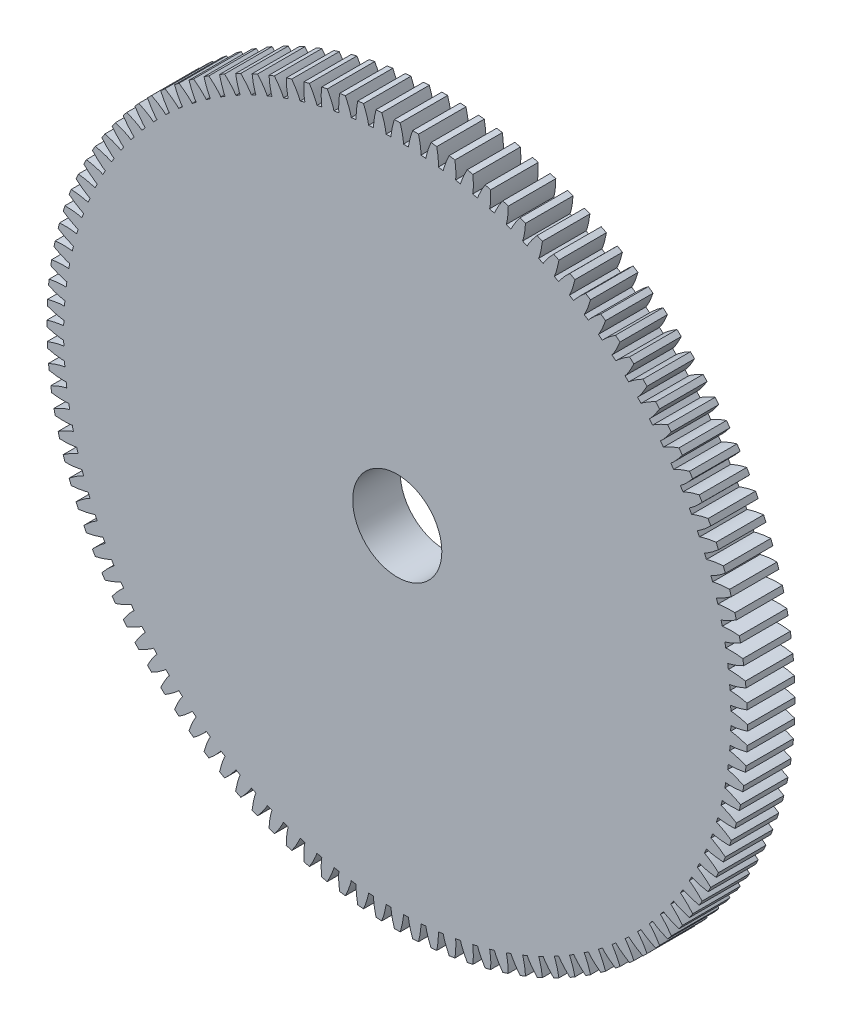
from build123d import *

# Parameters (mm, degrees)
SKETCH1_R               = 51.646666667
BOSS_EXTRUDE1_DEPTH     = 7
CUT_EXTRUDE2_DEPTH      = 9
CUT_EXTRUDE2_DEPTH_BACK = 9
SKETCH2_R               = 6.5713864
CUT_EXTRUDE4_DEPTH      = 8
CIRPATTERN1_COUNT       = 120


with BuildPart() as part:
    # Sketch1 → Boss-Extrude1 (new body)
    with BuildSketch(Plane.XY):
        Circle(SKETCH1_R)
    extrude(amount=BOSS_EXTRUDE1_DEPTH)

    # Sketch2 → Cut-Extrude2 (cut, two sides: drawn at the far end of the back side and taken through both)
    with BuildSketch(Plane.XY.offset(-CUT_EXTRUDE2_DEPTH_BACK)):
        Circle(SKETCH2_R)
    extrude(amount=CUT_EXTRUDE2_DEPTH + CUT_EXTRUDE2_DEPTH_BACK, mode=Mode.SUBTRACT)

    # Sketch3 → Cut-Extrude4 (cut, symmetric)
    with BuildSketch(Plane.XY):
        with BuildLine():
            add(Edge.make_bspline(
                [(49.173360836, 0.916442482), (49.18384042, 0.916566717), (49.203665183, 0.916389865), (49.236041745, 0.915655843), (49.281069512, 0.913831713), (49.334507278, 0.910924832), (49.397549658, 0.906541371), (49.466941868, 0.900717551), (49.542570383, 0.893292773), (49.61814797, 0.884920963), (49.693667957, 0.875669666), (49.769018057, 0.865640989), (49.860443016, 0.85252946), (49.97028668, 0.83546689), (50.099019249, 0.813561678), (50.245444605, 0.786397355), (50.395173351, 0.756216682), (50.542926147, 0.724464621), (50.692735499, 0.690005779), (50.838058678, 0.654980248), (50.989598286, 0.61614374), (51.129772372, 0.579049403), (51.287526258, 0.53475208), (51.415036017, 0.498206745), (51.54737887, 0.458157207), (51.611885358, 0.438324893), (51.64489264, 0.428045811)],
                knots=[1.3e-07, 1.3e-07, 1.3e-07, 1.3e-07, 1.3e-07, 0.015083688, 0.02853182, 0.04661014, 0.06485485, 0.092110526, 0.119476176, 0.146842496, 0.174208854, 0.201574956, 0.228941013, 0.256307345, 0.307035032, 0.361767352, 0.416499661, 0.471231937, 0.525964282, 0.580696616, 0.635428982, 0.690161387, 0.744893688, 0.799626082, 0.854358407, 0.909090989, 0.909090989, 0.909090989, 0.909090989, 0.909090989], degree=4))
            add(Edge.make_bspline(
                [(51.64489264, 0.428045811), (51.729651536, 0.428748255), (51.893906687, 0.430109643), (52.306530901, 0.433529575), (52.626157698, 0.436178722), (53.078541106, 0.439928189), (53.448425948, 0.442993886), (53.867627873, 0.446468337), (54.246446373, 0.449608079), (54.654621988, 0.45299114), (55.038305363, 0.456171204), (55.432204014, 0.459435934), (55.822263272, 0.462668842), (56.205473452, 0.465844984), (56.602827488, 0.469138353), (56.995750762, 0.472394999), (57.400093172, 0.47574629), (57.791188074, 0.478987782), (58.210246004, 0.482461039), (58.578360763, 0.485512066), (59.036526598, 0.489309459), (59.34843758, 0.491894655), (59.757270843, 0.495283167), (59.9172769, 0.496609337), (59.997819258, 0.497276892)],
                knots=[0.083333333, 0.083333333, 0.083333333, 0.083333333, 0.083333333, 0.123922085, 0.164486989, 0.203919128, 0.245640644, 0.283463065, 0.324862637, 0.363448184, 0.401437538, 0.443624084, 0.479586386, 0.519793574, 0.557377518, 0.596757987, 0.637386485, 0.67814217, 0.716036134, 0.757316468, 0.797189789, 0.837516216, 0.878097019, 0.916666667, 0.916666667, 0.916666667, 0.916666667, 0.916666667], degree=4))
            add(Edge.make_bspline(
                [(59.997819258, 0.497276892), (59.997642726, 0.518575974), (59.997269865, 0.560059567), (59.996273068, 0.664565782), (59.995261818, 0.744519575), (59.993781282, 0.86011974), (59.992303561, 0.954280053), (59.990545534, 1.061376264), (59.988676117, 1.160666778), (59.986596883, 1.264627477), (59.984361083, 1.365842191), (59.981947021, 1.468566009), (59.97935042, 1.570614564), (59.976602654, 1.672659161), (59.973637258, 1.775368542), (59.970572825, 1.876561557), (59.967208328, 1.9804886), (59.963878718, 2.079740878), (59.960029353, 2.186782325), (59.956577079, 2.280890933), (59.952005541, 2.396410157), (59.948830947, 2.476307301), (59.944356945, 2.580722462), (59.942558211, 2.622168717), (59.941619794, 2.643447849)],
                knots=[0.083333333, 0.083333333, 0.083333333, 0.083333333, 0.083333333, 0.123015873, 0.162698413, 0.202380952, 0.242063492, 0.281746032, 0.321428571, 0.361111111, 0.400793651, 0.44047619, 0.48015873, 0.51984127, 0.55952381, 0.599206349, 0.638888889, 0.678571429, 0.718253968, 0.757936508, 0.797619048, 0.837301587, 0.876984127, 0.916666667, 0.916666667, 0.916666667, 0.916666667, 0.916666667], degree=4))
            add(Edge.make_bspline(
                [(59.941619794, 2.643447849), (59.858319983, 2.639774296), (59.703135353, 2.632930595), (59.312499408, 2.615703403), (59.020783244, 2.60283861), (58.606088921, 2.584550435), (58.260277324, 2.569300013), (57.859465495, 2.551624061), (57.496042248, 2.535596959), (57.099188575, 2.518095563), (56.729728777, 2.501802247), (56.36779352, 2.485840766), (56.0012911, 2.469677871), (55.634949418, 2.453522065), (55.258889689, 2.43693769), (54.870819425, 2.419823645), (54.487394379, 2.402914456), (54.08400337, 2.385124761), (53.704331692, 2.368381097), (53.295388965, 2.350346569), (52.936963291, 2.334539862), (52.521463085, 2.316216147), (52.219639536, 2.302905615), (51.83711307, 2.286036054), (51.677727668, 2.279007097), (51.596517476, 2.275425697)],
                knots=[0.083333333, 0.083333333, 0.083333333, 0.083333333, 0.083333333, 0.123260854, 0.159318546, 0.197811954, 0.233027389, 0.269069906, 0.309877622, 0.349805143, 0.383267774, 0.424652171, 0.459252987, 0.493239183, 0.530412296, 0.570339816, 0.610221809, 0.64719005, 0.685114365, 0.729048295, 0.765971008, 0.80369045, 0.838966589, 0.877740749, 0.916666667, 0.916666667, 0.916666667, 0.916666667, 0.916666667], degree=4))
            add(Edge.make_bspline(
                [(49.153933527, 1.658348376), (49.164405251, 1.658772771), (49.18419359, 1.659986928), (49.216487364, 1.662414403), (49.261357955, 1.666592604), (49.314570352, 1.672292218), (49.377296922, 1.679969055), (49.446289237, 1.689416601), (49.521425523, 1.700789294), (49.596461387, 1.713105056), (49.671393701, 1.726296086), (49.746115676, 1.740254538), (49.836729136, 1.75813291), (49.945529277, 1.78092087), (50.072938992, 1.809533404), (50.217742007, 1.844323811), (50.36568602, 1.882299318), (50.511574552, 1.921740649), (50.659375159, 1.963992682), (50.802666082, 2.006575839), (50.951965465, 2.053290093), (51.09000608, 2.097669738), (51.245225426, 2.150162554), (51.370647803, 2.19333115), (51.500713254, 2.240252091), (51.564093395, 2.263433234), (51.596517476, 2.275425697)],
                knots=[0, 0, 0, 0, 0, 0.015083688, 0.02853182, 0.04661014, 0.06485485, 0.092110526, 0.119476176, 0.146842496, 0.174208854, 0.201574956, 0.228941013, 0.256307345, 0.307035032, 0.361767352, 0.416499661, 0.471231937, 0.525964282, 0.580696616, 0.635428982, 0.690161387, 0.744893688, 0.799626082, 0.854358407, 0.909090914, 0.909090914, 0.909090914, 0.909090914, 0.909090914], degree=4))
            add(Edge.make_bspline(
                [(49.153933527, 1.658348376), (49.154108307, 1.651673792), (49.154470369, 1.637847201), (49.155394419, 1.602559154), (49.156132466, 1.574374293), (49.157191942, 1.53391451), (49.158022611, 1.502192549), (49.158936078, 1.467308675), (49.159760078, 1.435841366), (49.160615387, 1.403178438), (49.161472634, 1.370441506), (49.162329541, 1.337717544), (49.16321808, 1.303785607), (49.164140847, 1.268546544), (49.165096303, 1.232059161), (49.166073376, 1.194746248), (49.167055942, 1.157223577), (49.167961336, 1.122647945), (49.168938851, 1.085318177), (49.169802717, 1.052328445), (49.170922006, 1.009584531), (49.171686192, 0.980401459), (49.172743501, 0.940024439), (49.173154617, 0.924324558), (49.173360836, 0.916442482)],
                knots=[0.083333333, 0.083333333, 0.083333333, 0.083333333, 0.083333333, 0.119319483, 0.159812843, 0.201093178, 0.243303571, 0.280291323, 0.314751221, 0.350761218, 0.38877442, 0.424593636, 0.463226877, 0.497138278, 0.541351877, 0.583276099, 0.626201923, 0.666552198, 0.706902473, 0.743675595, 0.785599817, 0.828954899, 0.874170101, 0.916666667, 0.916666667, 0.916666667, 0.916666667, 0.916666667], degree=4))
        make_face()
    cut_extrude4 = extrude(amount=CUT_EXTRUDE4_DEPTH, both=True, mode=Mode.SUBTRACT)

    # CirPattern1: Cut-Extrude4 ×120 about axis
    cirpattern1_axis = Axis((0, 0, -0.35), (0, 0, 1))
    for i in range(1, CIRPATTERN1_COUNT):
        add(cut_extrude4.rotate(cirpattern1_axis, i * 360 / CIRPATTERN1_COUNT), mode=Mode.SUBTRACT)


solid = part.part
